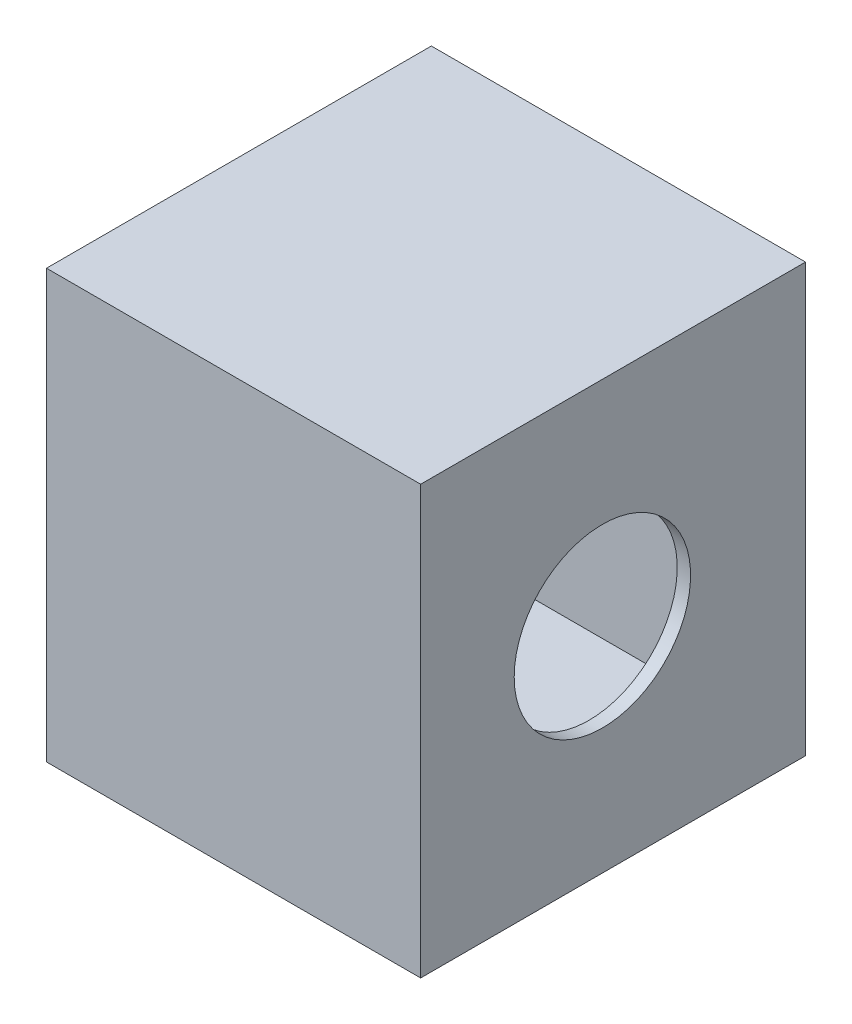
from build123d import *

# Parameters (mm, degrees)
S_BOX1_W       = 70
S_BOX1_H       = 80
BOSS_1_DEPTH   = 72
S_CUT2_W       = 68.5
S_CUT2_H       = 75
POCKET_2_DEPTH = 67
S_HOLE3_R      = 16.5
HOLE_3_DEPTH   = 2.7
S_HOLE4_R      = 1.5
HOLE_4_DEPTH   = 2.7
S_HOLE5_R      = 0.8
HOLE_5_DEPTH   = 2.7
S_HOLE6_R      = 0.8
HOLE_6_DEPTH   = 2.7


with BuildPart() as part:
    # S_box1 → Boss_1 (new body)
    with BuildSketch(Plane.XY):
        Rectangle(S_BOX1_W, S_BOX1_H)
    extrude(amount=BOSS_1_DEPTH)

    # S_cut2 → Pocket_2 (cut)
    with BuildSketch(Plane.XY.offset(2.5)):
        with Locations((-1.75, 0)):
            Rectangle(S_CUT2_W, S_CUT2_H)
    extrude(amount=POCKET_2_DEPTH, mode=Mode.SUBTRACT)

    # S_hole3 → Hole_3 (cut)
    with BuildSketch(Plane(origin=(32.4, 0, 0), x_dir=(0, 0, -1), z_dir=(1, 0, 0))):
        with Locations((-38, 0)):
            Circle(S_HOLE3_R)
    extrude(amount=HOLE_3_DEPTH, mode=Mode.SUBTRACT)

    # S_hole4 → Hole_4 (cut)
    with BuildSketch(Plane.XY.offset(-0.1)):
        Circle(S_HOLE4_R)
    extrude(amount=HOLE_4_DEPTH, mode=Mode.SUBTRACT)

    # S_hole5 → Hole_5 (cut)
    with BuildSketch(Plane.XY.offset(-0.1)):
        with Locations((0, 7)):
            Circle(S_HOLE5_R)
    extrude(amount=HOLE_5_DEPTH, mode=Mode.SUBTRACT)

    # S_hole6 → Hole_6 (cut)
    with BuildSketch(Plane.XY.offset(-0.1)):
        with Locations((0, -7)):
            Circle(S_HOLE6_R)
    extrude(amount=HOLE_6_DEPTH, mode=Mode.SUBTRACT)


solid = part.part
